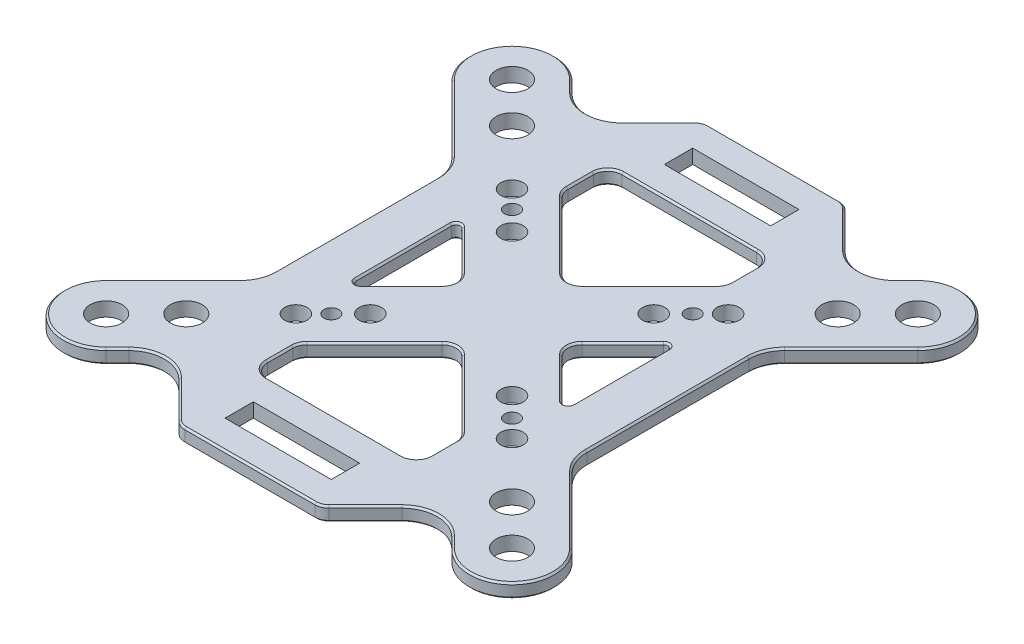
from build123d import *

# Parameters (mm, degrees)
SKETCH1_R           = 2.25
SKETCH1_R_2         = 1.575
SKETCH1_R_3         = 1.05
BOSS_EXTRUDE1_DEPTH = 2
MIRROR1_OUTLINE_R   = 2.25
MIRROR1_OUTLINE_R_2 = 1.575
MIRROR1_OUTLINE_R_3 = 1.05
MIRROR1_OUTLINE_W   = 15
MIRROR1_OUTLINE_H   = 4
MIRROR1_DEPTH       = 2
FILLET1_R           = 2
FILLET2_R           = 0.6
CHAMFER6_SIZE       = 0.25


# Read off the part's stored shape, not the designer's step: Mirror1
with BuildPart() as part:
    # Sketch1 → Boss-Extrude1 (new body)
    with BuildSketch(Plane(origin=(0, 0, 0), x_dir=(1, 0, 0), z_dir=(0, 1, 0))):
        with BuildLine():
            Line((-7.071067812, 0), (0, 0))
            Line((0, 0), (0, 7.071067812))
            Line((0, 7.071067812), (-11.5, 18.571067812))
            Line((-11.5, 18.571067812), (-11.5, 25))
            Line((-11.5, 25), (0, 25))
            Line((0, 25), (0, 29))
            Line((0, 29), (-7.5, 29))
            Line((-7.5, 29), (-7.5, 33))
            Line((-7.5, 33), (0, 33))
            Line((0, 33), (0, 37))
            Line((0, 37), (-9.171572875, 37))
            ThreePointArc((-9.171572875, 37), (-9.93693974, 36.847759065), (-10.585786438, 36.414213562))
            Line((-10.585786438, 36.414213562), (-15.721825407, 31.278174593))
            ThreePointArc((-15.721825407, 31.278174593), (-19.257359313, 29.813708499), (-22.792893219, 31.278174593))
            Line((-22.792893219, 31.278174593), (-24.395183951, 32.880465325))
            ThreePointArc((-24.395183951, 32.880465325), (-32.880465325, 32.880465325), (-32.880465325, 24.395183951))
            Line((-32.880465325, 24.395183951), (-23.464466094, 14.97918472))
            ThreePointArc((-23.464466094, 14.97918472), (-22.380602337, 13.357067976), (-22, 11.443650814))
            Line((-22, 11.443650814), (-22, 0))
            Line((-22, 0), (-15.25, 0))
            Line((-15.25, 0), (-15.25, 8.178932188))
            Line((-15.25, 8.178932188), (-7.071067812, 0))
        make_face()
        with Locations(Location((-22.980970389, 22.980970389, 0), (0, 0, 270))):
            Circle(SKETCH1_R, mode=Mode.SUBTRACT)
        with Locations(Location((-28.637824638, 28.637824638, 0), (0, 0, 270))):
            Circle(SKETCH1_R, mode=Mode.SUBTRACT)
        with Locations(Location((-15.25, 15.25, 0), (0, 0, 270))):
            Circle(SKETCH1_R_2, mode=Mode.SUBTRACT)
        with Locations(Location((-12.75, 12.75, 0), (0, 0, 270))):
            Circle(SKETCH1_R_3, mode=Mode.SUBTRACT)
        with Locations(Location((-10, 10, 0), (0, 0, 270))):
            Circle(SKETCH1_R_2, mode=Mode.SUBTRACT)
    extrude(amount=BOSS_EXTRUDE1_DEPTH)

    # Mirror1 outline → Mirror1 (add)
    with BuildSketch(Plane(origin=(0, 0, 0), x_dir=(1, 0, 0), z_dir=(0, 1, 0))):
        with BuildLine():
            Line((32.880465325, -24.395183951), (23.464466094, -14.97918472))
            ThreePointArc((23.464466094, -14.97918472), (22.380602337, -13.357067976), (22, -11.443650814))
            Line((22, -11.443650814), (22, 11.443650814))
            ThreePointArc((22, 11.443650814), (22.380602337, 13.357067976), (23.464466094, 14.97918472))
            Line((23.464466094, 14.97918472), (32.880465325, 24.395183951))
            ThreePointArc((32.880465325, 24.395183951), (32.880465325, 32.880465325), (24.395183951, 32.880465325))
            Line((24.395183951, 32.880465325), (22.792893219, 31.278174593))
            ThreePointArc((22.792893219, 31.278174593), (19.257359313, 29.813708499), (15.721825407, 31.278174593))
            Line((15.721825407, 31.278174593), (10.585786438, 36.414213562))
            ThreePointArc((10.585786438, 36.414213562), (9.93693974, 36.847759065), (9.171572875, 37))
            Line((9.171572875, 37), (0, 37))
            Line((0, 37), (0, 33))
            Line((0, 33), (7.5, 33))
            Line((7.5, 33), (7.5, 29))
            Line((7.5, 29), (0, 29))
            Line((0, 29), (0, 25))
            Line((0, 25), (11.5, 25))
            Line((11.5, 25), (11.5, 18.571067812))
            Line((11.5, 18.571067812), (0, 7.071067812))
            Line((0, 7.071067812), (0, 0))
            Line((0, 0), (-7.071067812, 0))
            Line((-7.071067812, 0), (-15.25, -8.178932188))
            Line((-15.25, -8.178932188), (-15.25, 0))
            Line((-15.25, 0), (-22, 0))
            Line((-22, 0), (-22, -11.443650814))
            ThreePointArc((-22, -11.443650814), (-22.380602337, -13.357067976), (-23.464466094, -14.97918472))
            Line((-23.464466094, -14.97918472), (-32.880465325, -24.395183951))
            ThreePointArc((-32.880465325, -24.395183951), (-32.880465325, -32.880465325), (-24.395183951, -32.880465325))
            Line((-24.395183951, -32.880465325), (-22.792893219, -31.278174593))
            ThreePointArc((-22.792893219, -31.278174593), (-19.257359313, -29.813708499), (-15.721825407, -31.278174593))
            Line((-15.721825407, -31.278174593), (-10.585786438, -36.414213562))
            ThreePointArc((-10.585786438, -36.414213562), (-9.93693974, -36.847759065), (-9.171572875, -37))
            Line((-9.171572875, -37), (9.171572875, -37))
            ThreePointArc((9.171572875, -37), (9.93693974, -36.847759065), (10.585786438, -36.414213562))
            Line((10.585786438, -36.414213562), (15.721825407, -31.278174593))
            ThreePointArc((15.721825407, -31.278174593), (19.257359313, -29.813708499), (22.792893219, -31.278174593))
            Line((22.792893219, -31.278174593), (24.395183951, -32.880465325))
            ThreePointArc((24.395183951, -32.880465325), (32.880465325, -32.880465325), (32.880465325, -24.395183951))
        make_face()
        with Locations((-28.637824638, -28.637824638)):
            Circle(MIRROR1_OUTLINE_R, mode=Mode.SUBTRACT)
        with Locations((-22.980970389, -22.980970389)):
            Circle(MIRROR1_OUTLINE_R, mode=Mode.SUBTRACT)
        with Locations((-15.25, -15.25)):
            Circle(MIRROR1_OUTLINE_R_2, mode=Mode.SUBTRACT)
        with Locations((-12.75, -12.75)):
            Circle(MIRROR1_OUTLINE_R_3, mode=Mode.SUBTRACT)
        with Locations((-10, -10)):
            Circle(MIRROR1_OUTLINE_R_2, mode=Mode.SUBTRACT)
        with Locations((0, -31)):
            Rectangle(MIRROR1_OUTLINE_W, MIRROR1_OUTLINE_H, mode=Mode.SUBTRACT)
        with Locations((28.637824638, -28.637824638)):
            Circle(MIRROR1_OUTLINE_R, mode=Mode.SUBTRACT)
        with Locations((22.980970389, -22.980970389)):
            Circle(MIRROR1_OUTLINE_R, mode=Mode.SUBTRACT)
        Polygon((-11.5, -18.571067812), (0, -7.071067812), (11.5, -18.571067812), (11.5, -25), (-11.5, -25), align=None, mode=Mode.SUBTRACT)
        with Locations((15.25, -15.25)):
            Circle(MIRROR1_OUTLINE_R_2, mode=Mode.SUBTRACT)
        with Locations((12.75, -12.75)):
            Circle(MIRROR1_OUTLINE_R_3, mode=Mode.SUBTRACT)
        with Locations((10, -10)):
            Circle(MIRROR1_OUTLINE_R_2, mode=Mode.SUBTRACT)
        Polygon((15.25, -8.178932188), (7.071067812, 0), (15.25, 8.178932188), align=None, mode=Mode.SUBTRACT)
        with Locations((10, 10)):
            Circle(MIRROR1_OUTLINE_R_2, mode=Mode.SUBTRACT)
        with Locations((12.75, 12.75)):
            Circle(MIRROR1_OUTLINE_R_3, mode=Mode.SUBTRACT)
        with Locations((15.25, 15.25)):
            Circle(MIRROR1_OUTLINE_R_2, mode=Mode.SUBTRACT)
        with Locations((22.980970389, 22.980970389)):
            Circle(MIRROR1_OUTLINE_R, mode=Mode.SUBTRACT)
        with Locations((28.637824638, 28.637824638)):
            Circle(MIRROR1_OUTLINE_R, mode=Mode.SUBTRACT)
    extrude(amount=MIRROR1_DEPTH)

    # Fillet1
    fillet1_edges = [part.edges().sort_by_distance(p)[0] for p in [
        (-11.5, 1, 25),
        (-11.5, 1, 18.571067812),
        (0, 1, 7.071067812),
        (11.5, 1, 18.571067812),
        (11.5, 1, 25),
        (-11.5, 1, -25),
        (-11.5, 1, -18.571067812),
        (0, 1, -7.071067812),
        (-7.071067812, 1, 0),
        (11.5, 1, -25),
        (11.5, 1, -18.571067812),
        (7.071067812, 1, 0),
    ]]
    fillet(fillet1_edges, radius=FILLET1_R)

    # Fillet2
    fillet2_edges = [part.edges().sort_by_distance(p)[0] for p in [
        (-15.25, 1, 8.178932188),
        (15.25, 1, 8.178932188),
        (-15.25, 1, -8.178932188),
        (15.25, 1, -8.178932188),
    ]]
    fillet(fillet2_edges, radius=FILLET2_R)

    # Chamfer6
    chamfer6_edges = [part.edges().sort_by_distance(p)[0] for p in [
        (-23.594038585, 2, -32.079319959),
        (-9.93693974, 2, -36.847759065),
        (-13.153805922, 2, -33.846194078),
        (-19.257359313, 2, -29.813708499),
        (-23.594038585, 0, 32.079319959),
        (-19.257359313, 0, 29.813708499),
        (-13.153805923, 2, 33.846194078),
        (-9.93693974, 2, 36.847759065),
        (0, 2, 37),
        (-22.380602337, 0, 13.357067976),
        (-28.17246571, 2, 19.687184335),
        (-32.880465325, 2, 32.880465325),
        (-23.594038585, 2, 32.079319959),
        (-19.257359313, 2, 29.813708499),
        (-32.880465325, 2, -32.880465325),
        (-22.380602337, 2, 13.357067976),
        (-32.880465325, 0, 32.880465325),
        (-28.17246571, 0, 19.687184335),
        (0, 0, 37),
        (-9.93693974, 0, 36.847759065),
        (-13.153805923, 0, 33.846194078),
        (23.594038585, 2, 32.079319959),
        (32.880465325, 0, 32.880465325),
        (28.17246571, 0, 19.687184335),
        (22.380602337, 2, 13.357067976),
        (9.93693974, 0, 36.847759065),
        (13.153805923, 0, 33.846194078),
        (19.257359313, 2, 29.813708499),
        (32.880465325, 2, 32.880465325),
        (28.17246571, 2, 19.687184335),
        (9.93693974, 2, 36.847759065),
        (13.153805923, 2, 33.846194078),
        (23.594038585, 0, 32.079319959),
        (19.257359313, 0, 29.813708499),
        (22.380602337, 0, 13.357067976),
        (-28.17246571, 2, -19.687184335),
        (-22.380602337, 2, -13.357067976),
        (6.164213562, 0, 13.235281374),
        (6.164213562, 2, 13.235281374),
        (-6.164213562, 0, 13.235281374),
        (-6.164213562, 2, 13.235281374),
        (-6.164213562, 0, -13.235281374),
        (-6.164213562, 2, -13.235281374),
        (6.164213562, 0, -13.235281374),
        (6.164213562, 2, -13.235281374),
        (-11.5, 0, -21.199747468),
        (-11.5, 2, -21.199747468),
        (11.5, 0, -21.199747468),
        (11.5, 2, -21.199747468),
        (11.5, 0, 21.199747468),
        (11.5, 2, 21.199747468),
        (-11.5, 0, 21.199747468),
        (-11.5, 2, 21.199747468),
        (0, 0, 25),
        (0, 2, 25),
        (0, 0, -25),
        (0, 2, -25),
        (-7.899494937, 0, 0),
        (-7.899494937, 2, 0),
        (7.899494937, 0, 0),
        (7.899494937, 2, 0),
        (0, 0, 7.899494937),
        (0, 2, 7.899494937),
        (0, 0, -7.899494937),
        (-22, 2, 0),
        (0, 2, -7.899494937),
        (-11.347759065, 0, -18.634128072),
        (-11.347759065, 2, -18.634128072),
        (11.347759065, 0, -18.634128072),
        (11.347759065, 2, -18.634128072),
        (11.347759065, 0, 18.634128072),
        (11.347759065, 2, 18.634128072),
        (-11.347759065, 0, 18.634128072),
        (-11.347759065, 2, 18.634128072),
        (-10.914213562, 0, 24.414213562),
        (-19.257359313, 0, -29.813708499),
        (-10.914213562, 2, 24.414213562),
        (10.914213562, 0, 24.414213562),
        (10.914213562, 2, 24.414213562),
        (-13.153805922, 0, -33.846194078),
        (10.914213562, 0, -24.414213562),
        (10.914213562, 2, -24.414213562),
        (-10.914213562, 0, -24.414213562),
        (-9.93693974, 0, -36.847759065),
        (-10.914213562, 2, -24.414213562),
        (0, 0, -37),
        (-22, 0, 0),
        (11.355508653, 0, 4.284440841),
        (11.355508653, 2, 4.284440841),
        (15.25, 0, 0),
        (15.25, 2, 0),
        (-22.380602337, 0, -13.357067976),
        (11.355508653, 2, -4.284440841),
        (11.355508653, 0, -4.284440841),
        (-15.25, 0, 0),
        (-15.25, 2, 0),
        (-11.355508653, 2, 4.284440841),
        (-11.355508653, 0, 4.284440841),
        (-11.355508653, 0, -4.284440841),
        (-11.355508653, 2, -4.284440841),
        (-28.17246571, 0, -19.687184335),
        (14.879610059, 0, 7.28473177),
        (14.879610059, 2, 7.28473177),
        (14.879610059, 0, -7.28473177),
        (-32.880465325, 0, -32.880465325),
        (14.879610059, 2, -7.28473177),
        (-14.879610059, 0, 7.28473177),
        (-14.879610059, 2, 7.28473177),
        (-23.594038585, 0, -32.079319959),
        (-14.879610059, 0, -7.28473177),
        (-14.879610059, 2, -7.28473177),
        (23.594038585, 0, -32.079319959),
        (19.257359313, 0, -29.813708499),
        (13.153805923, 2, -33.846194078),
        (9.93693974, 2, -36.847759065),
        (22, 0, 0),
        (22.380602337, 0, -13.357067976),
        (28.17246571, 2, -19.687184335),
        (32.880465325, 2, -32.880465325),
        (23.594038585, 2, -32.079319959),
        (19.257359313, 2, -29.813708499),
        (22, 2, 0),
        (22.380602337, 2, -13.357067976),
        (0, 2, -37),
        (32.880465325, 0, -32.880465325),
        (28.17246571, 0, -19.687184335),
        (9.93693974, 0, -36.847759065),
        (13.153805923, 0, -33.846194078),
    ]]
    chamfer(chamfer6_edges, length=CHAMFER6_SIZE)


solid = part.part
